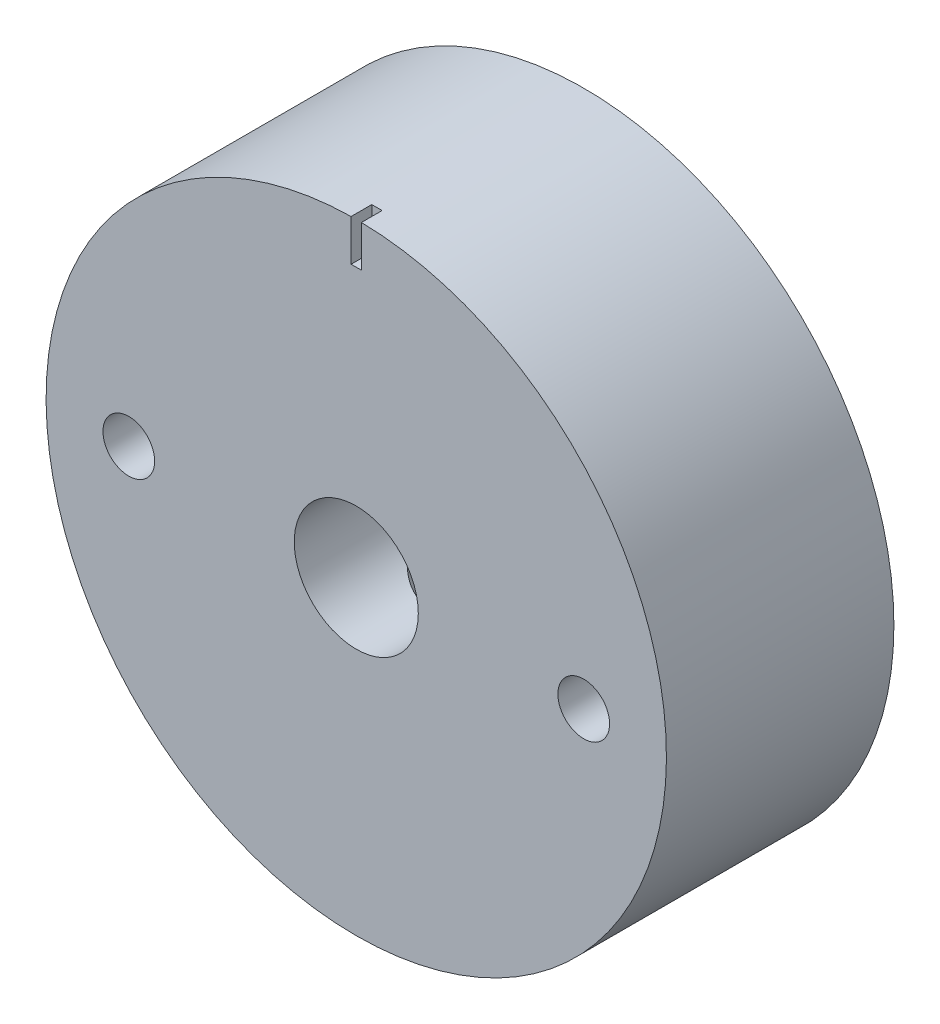
from build123d import *

# Parameters (mm, degrees)
CROQUIS1_R              = 15
CROQUIS1_R_2            = 3
SALIENTE_EXTRUIR1_DEPTH = 11
CORTAR_EXTRUIR1_START   = -1
CORTAR_EXTRUIR1_DEPTH   = 1
CROQUIS3_R              = 1.25
CORTAR_EXTRUIR2_DEPTH   = 24.895606291
CROQUIS4_R              = 2.5
CORTAR_EXTRUIR3_DEPTH   = 16


# Read off the part's stored shape, not the designer's step: Cortar-Extruir1
with BuildPart() as part:
    # Croquis1 → Saliente-Extruir1 (new body)
    with BuildSketch(Plane.XY):
        Circle(CROQUIS1_R)
        Circle(CROQUIS1_R_2, mode=Mode.SUBTRACT)
    extrude(amount=SALIENTE_EXTRUIR1_DEPTH)

    # Cortar-Extruir1 outline → Cortar-Extruir1 (cut)
    with BuildSketch(Plane.XY.offset(11).offset(CORTAR_EXTRUIR1_START)):
        with BuildLine():
            Line((-0.25, 14.997916522), (-0.25, 12.997916522))
            Line((-0.25, 12.997916522), (0.25, 12.997916522))
            Line((0.25, 12.997916522), (0.25, 14.997916522))
            ThreePointArc((0.25, 14.997916522), (0, 15), (-0.25, 14.997916522))
        make_face()
    extrude(amount=CORTAR_EXTRUIR1_DEPTH, mode=Mode.SUBTRACT)

    # Croquis3 → Cortar-Extruir2 (cut, through all)
    with BuildSketch(Plane.XY.offset(11)):
        with Locations((11, 0)):
            Circle(CROQUIS3_R)
        with Locations((-11, 0)):
            Circle(CROQUIS3_R)
    extrude(amount=-CORTAR_EXTRUIR2_DEPTH, mode=Mode.SUBTRACT)

    # Croquis4 → Cortar-Extruir3 (cut)
    with BuildSketch(Plane(origin=(0, 0, 0), x_dir=(1, 0, 0), z_dir=(0, 1, 0))):
        with Locations(Location((0, -5, 0), (0, 0, 270))):
            Circle(CROQUIS4_R)
    extrude(amount=-CORTAR_EXTRUIR3_DEPTH, mode=Mode.SUBTRACT)


solid = part.part
